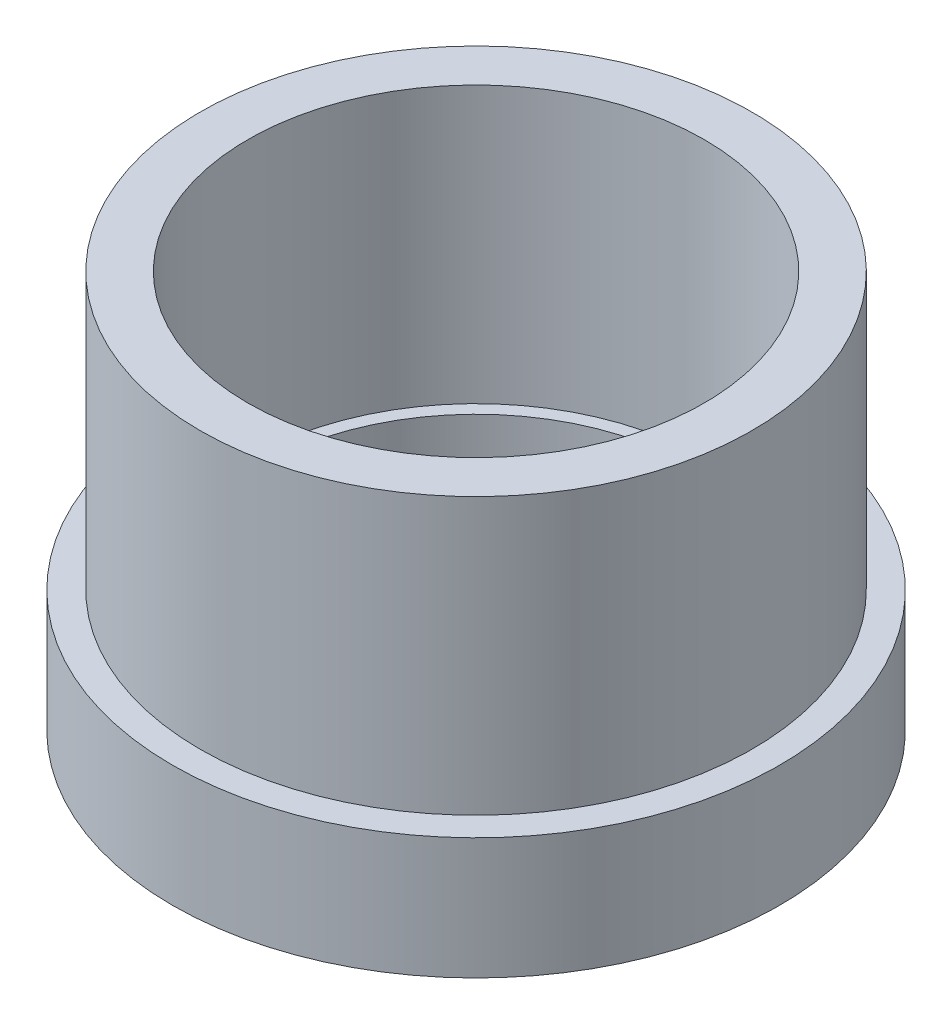
from build123d import *

# Parameters (mm, degrees)
SKETCH4_R           = 50
SKETCH4_R_2         = 41.35
BOSS_EXTRUDE1_DEPTH = 50
SKETCH3_R           = 1.6
CUT_EXTRUDE1_DEPTH  = 10


with BuildPart() as part:
    # Sketch1 → Revolve1 (revolve)
    with BuildSketch(Plane.XY):
        Polygon((39, 0), (39, 10), (55, 10), (55, -12), (41.5, -12), (41.5, 0), align=None)
    revolve(axis=Axis((0, 83.520836207, 0), (0, -1, 0)))

    # Sketch4 → Boss-Extrude1 (add)
    with BuildSketch(Plane(origin=(0, 10, 0), x_dir=(1, 0, 0), z_dir=(0, 1, 0))):
        Circle(SKETCH4_R)
        Circle(SKETCH4_R_2, mode=Mode.SUBTRACT)
    extrude(amount=BOSS_EXTRUDE1_DEPTH)

    # Sketch3 → Cut-Extrude1 (cut)
    with BuildSketch(Plane.XZ.offset(12)):
        with Locations((0, 48.25)):
            Circle(SKETCH3_R)
        with Locations((48.25, 0)):
            Circle(SKETCH3_R)
        with Locations((0, -48.25)):
            Circle(SKETCH3_R)
        with Locations((-48.25, 0)):
            Circle(SKETCH3_R)
    extrude(amount=-CUT_EXTRUDE1_DEPTH, mode=Mode.SUBTRACT)


solid = part.part
